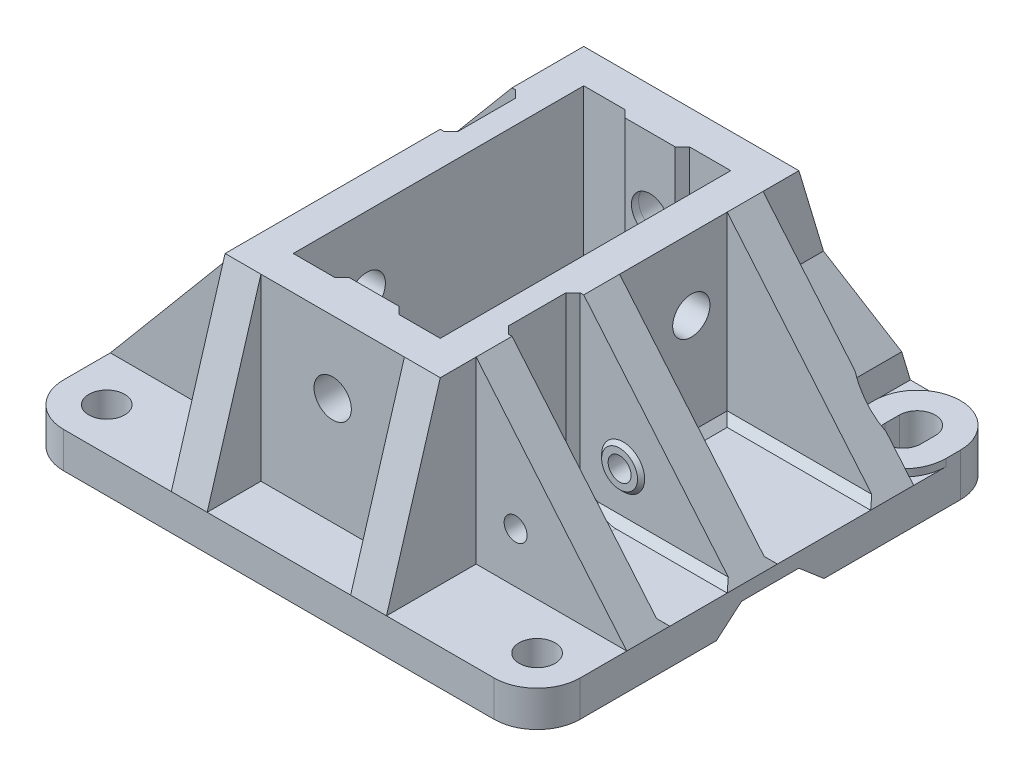
from build123d import *

# Parameters (mm, degrees)
SKETCH1_W               = 72
SKETCH1_H               = 65
BOSS_EXTRUDE1_DEPTH     = 5
SKETCH2_W               = 30
SKETCH2_H               = 50
BOSS_EXTRUDE2_DEPTH     = 25
SKETCH4_W               = 20.5
SKETCH4_H               = 40.5
CUT_EXTRUDE1_DEPTH      = 25
BOSS_EXTRUDE3_DEPTH     = 5
MIRROR2_COPY_1_DEPTH    = 5
BOSS_EXTRUDE4_START     = -5
BOSS_EXTRUDE4_DEPTH     = 5
BOSS_EXTRUDE5_DEPTH     = 5
MIRROR4_START           = -5
MIRROR4_COPY_1_DEPTH    = 5
BOSS_EXTRUDE6_DEPTH     = 5
FILLET1_R               = 6
CUT_EXTRUDE3_DEPTH      = 75
SKETCH11_R              = 2.5
CUT_EXTRUDE4_DEPTH      = 5
SKETCH12_R              = 1.6
CUT_EXTRUDE5_DEPTH      = 5
SKETCH13_R              = 2.602149029
CUT_EXTRUDE6_DEPTH      = 7
SKETCH14_W              = 7
SKETCH14_H              = 25
BOSS_EXTRUDE7_DEPTH     = 1
BOSS_EXTRUDE8_DEPTH     = 25
MIRROR8_COPY_1_DEPTH    = 25
MIRROR8_COPY_2_DEPTH    = 25
SKETCH16_R              = 2.6
CUT_EXTRUDE7_DEPTH      = 65
CUT_EXTRUDE8_DEPTH      = 102.533245787
CUT_EXTRUDE8_DEPTH_BACK = 25
FILLET5_R               = 7
CUT_EXTRUDE9_DEPTH      = 25
FILLET6_R               = 7
BOSS_EXTRUDE10_DEPTH    = 25
BOSS_EXTRUDE11_DEPTH    = 25
BOSS_EXTRUDE12_DEPTH    = 15
BOSS_EXTRUDE13_DEPTH    = 25
BOSS_EXTRUDE14_DEPTH    = 25
SKETCH28_W              = 39.163365543
SKETCH28_H              = 8.307401159
CUT_EXTRUDE10_DEPTH     = 5
BOSS_EXTRUDE15_DEPTH    = 25
BOSS_EXTRUDE16_DEPTH    = 15
BOSS_EXTRUDE17_DEPTH    = 25
SKETCH32_R              = 3
BOSS_EXTRUDE18_DEPTH    = 0.5
BOSS_EXTRUDE18_TAPER    = 45
SKETCH33_R              = 1.6
CUT_EXTRUDE11_DEPTH     = 20.5
SKETCH34_R              = 3
BOSS_EXTRUDE19_DEPTH    = 0.5
BOSS_EXTRUDE19_TAPER    = 45
CUT_EXTRUDE12_START     = -10.5
SKETCH35_R              = 1.6
CUT_EXTRUDE12_DEPTH     = 10.5
SKETCH37_R              = 3
BOSS_EXTRUDE20_DEPTH    = 0.5
BOSS_EXTRUDE20_TAPER    = 45
SKETCH38_R              = 3
BOSS_EXTRUDE21_DEPTH    = 0.5
BOSS_EXTRUDE21_TAPER    = 45
SKETCH36_R              = 1.6
CUT_EXTRUDE13_DEPTH     = 20.5
SKETCH40_R              = 2.6
CUT_EXTRUDE14_DEPTH     = 10
SKETCH41_R              = 2.6
CUT_EXTRUDE15_DEPTH     = 10
BOSS_EXTRUDE22_START    = 1
BOSS_EXTRUDE22_DEPTH    = 1
CUT_EXTRUDE17_DEPTH     = 11
CUT_EXTRUDE18_DEPTH     = 10
BOSS_EXTRUDE23_DEPTH    = 12.5
SKETCH50_R              = 2
CUT_EXTRUDE20_DEPTH     = 12.5
SKETCH49_W              = 13.457304279
SKETCH49_H              = 22.246433757
CUT_EXTRUDE21_DEPTH     = 12.5


with BuildPart() as part:
    # Sketch1 → Boss-Extrude1 (new body)
    with BuildSketch(Plane(origin=(0, 0, 0), x_dir=(1, 0, 0), z_dir=(0, 1, 0))):
        with Locations((36, 32.5)):
            Rectangle(SKETCH1_W, SKETCH1_H)
    extrude(amount=BOSS_EXTRUDE1_DEPTH)

    # Sketch2 → Boss-Extrude2 (add)
    with BuildSketch(Plane(origin=(0, 5, 0), x_dir=(1, 0, 0), z_dir=(0, 1, 0))):
        with Locations((36, 32.5)):
            Rectangle(SKETCH2_W, SKETCH2_H)
    extrude(amount=BOSS_EXTRUDE2_DEPTH)

    # Sketch4 → Cut-Extrude1 (cut)
    with BuildSketch(Plane(origin=(0, 30, 0), x_dir=(1, 0, 0), z_dir=(0, 1, 0))):
        with Locations((36, 32.5)):
            Rectangle(SKETCH4_W, SKETCH4_H)
    extrude(amount=-CUT_EXTRUDE1_DEPTH, mode=Mode.SUBTRACT)

    # Sketch5 → Boss-Extrude3 (add)
    with BuildSketch(Plane(origin=(51, 0, 0), x_dir=(0, 0, -1), z_dir=(1, 0, 0))):
        Polygon((57.5, 30), (65, 5), (57.5, 5), align=None)
    boss_extrude3 = extrude(amount=-BOSS_EXTRUDE3_DEPTH)

    # Mirror1: Boss-Extrude3 across plane
    add(boss_extrude3.mirror(Plane(origin=(36, 0, 0), x_dir=(0, 0, 1), z_dir=(1, 0, 0))))

    # Mirror2: Boss-Extrude3 across plane
    add(boss_extrude3.mirror(Plane.XY.offset(-32.5)))

    # Mirror2 copy 1 sketch → Mirror2 copy 1 (add)
    with BuildSketch(Plane(origin=(21, 0, -65), x_dir=(0, 0, 1), z_dir=(-1, 0, 0))):
        Polygon((57.5, 30), (65, 5), (57.5, 5), align=None)
    extrude(amount=-MIRROR2_COPY_1_DEPTH)

    # Sketch6 → Boss-Extrude4 (add)
    with BuildSketch(Plane.XY.offset(-7.5).offset(BOSS_EXTRUDE4_START)):
        Polygon((51, 30), (72, 5), (51, 5), align=None)
    boss_extrude4 = extrude(amount=-BOSS_EXTRUDE4_DEPTH)

    # Mirror3: Boss-Extrude4 across plane
    add(boss_extrude4.mirror(Plane.XY.offset(-32.5)))

    # Sketch7 → Boss-Extrude5 (add)
    with BuildSketch(Plane.XY.offset(-32.5)):
        Polygon((51, 30), (72, 5), (51, 5), align=None)
    extrude(amount=BOSS_EXTRUDE5_DEPTH)

    # Mirror4: Boss-Extrude4 across plane
    add(boss_extrude4.mirror(Plane(origin=(36, 0, 0), x_dir=(0, 0, 1), z_dir=(1, 0, 0))))

    # Mirror4 copy 1 sketch → Mirror4 copy 1 (add)
    with BuildSketch(Plane(origin=(72, 0, -57.5), x_dir=(-1, 0, 0), z_dir=(0, 0, -1)).offset(MIRROR4_START)):
        Polygon((51, 30), (72, 5), (51, 5), align=None)
    extrude(amount=-MIRROR4_COPY_1_DEPTH)

    # Sketch8 → Boss-Extrude6 (add)
    with BuildSketch(Plane.XY.offset(-32.5)):
        Polygon((21, 30), (0, 5), (21, 5), align=None)
    extrude(amount=-BOSS_EXTRUDE6_DEPTH)

    # Fillet1
    fillet1_edges = [part.edges().sort_by_distance(p)[0] for p in [
        (0, 2.5, -65),
        (0, 2.5, 0),
        (72, 2.5, 0),
        (72, 2.5, -65),
    ]]
    fillet(fillet1_edges, radius=FILLET1_R)

    # Sketch10 → Cut-Extrude3 (cut)
    with BuildSketch(Plane(origin=(72, 0, 0), x_dir=(0, 0, -1), z_dir=(1, 0, 0))):
        Polygon((40, 0), (36.5, 3), (32.5, 3), (28.5, 3), (25, 0), align=None)
    extrude(amount=-CUT_EXTRUDE3_DEPTH, mode=Mode.SUBTRACT)

    # Sketch11 → Cut-Extrude4 (cut)
    with BuildSketch(Plane(origin=(0, 5, 0), x_dir=(1, 0, 0), z_dir=(0, 1, 0))):
        with Locations((66, 6)):
            Circle(SKETCH11_R)
    cut_extrude4 = extrude(amount=-CUT_EXTRUDE4_DEPTH, mode=Mode.SUBTRACT)

    # Mirror6: Cut-Extrude4 across plane
    add(cut_extrude4.mirror(Plane(origin=(36, 0, 0), x_dir=(0, 0, 1), z_dir=(1, 0, 0))), mode=Mode.SUBTRACT)

    # Sketch12 → Cut-Extrude5 (cut)
    with BuildSketch(Plane.XY.offset(-12.5)):
        with Locations((56.5, 12)):
            Circle(SKETCH12_R)
    extrude(amount=-CUT_EXTRUDE5_DEPTH, mode=Mode.SUBTRACT)

    # Sketch13 → Cut-Extrude6 (cut)
    with BuildSketch(Plane.XY.offset(-7.5)):
        with Locations((36, 20)):
            Circle(SKETCH13_R)
    cut_extrude6 = extrude(amount=-CUT_EXTRUDE6_DEPTH, mode=Mode.SUBTRACT)

    # Sketch14 → Boss-Extrude7 (add)
    with BuildSketch(Plane(origin=(0, 0, -12.25), x_dir=(-1, 0, 0), z_dir=(0, 0, -1))):
        with Locations((-36, 17.5)):
            Rectangle(SKETCH14_W, SKETCH14_H)
    boss_extrude7 = extrude(amount=BOSS_EXTRUDE7_DEPTH)

    # Sketch15 → Boss-Extrude8 (add)
    with BuildSketch(Plane(origin=(0, 30, 0), x_dir=(1, 0, 0), z_dir=(0, 1, 0))):
        Polygon((39.5, 13.25), (40.5, 12.25), (39.5, 12.25), align=None)
    boss_extrude8 = extrude(amount=-BOSS_EXTRUDE8_DEPTH)

    # Mirror7: Boss-Extrude8 across plane
    add(boss_extrude8.mirror(Plane(origin=(36, 0, 0), x_dir=(0, 0, 1), z_dir=(1, 0, 0))))

    # Mirror8: Cut-Extrude6, Boss-Extrude7 across plane
    add(cut_extrude6.mirror(Plane.XY.offset(-32.5)), mode=Mode.SUBTRACT)
    add(boss_extrude7.mirror(Plane.XY.offset(-32.5)))

    # Mirror8 copy 1 sketch → Mirror8 copy 1 (add)
    with BuildSketch(Plane(origin=(72, 30, -65), x_dir=(-1, 0, 0), z_dir=(0, 1, 0))):
        Polygon((39.5, 13.25), (40.5, 12.25), (39.5, 12.25), align=None)
    extrude(amount=-MIRROR8_COPY_1_DEPTH)

    # Mirror8 copy 2 sketch → Mirror8 copy 2 (add)
    with BuildSketch(Plane(origin=(0, 30, -65), x_dir=(1, 0, 0), z_dir=(0, 1, 0))):
        Polygon((39.5, -13.25), (40.5, -12.25), (39.5, -12.25), align=None)
    extrude(amount=-MIRROR8_COPY_2_DEPTH)

    # Sketch16 → Cut-Extrude7 (cut)
    with BuildSketch(Plane.XY.offset(-12.25)):
        with Locations((36, 20)):
            Circle(SKETCH16_R)
    extrude(amount=-CUT_EXTRUDE7_DEPTH, mode=Mode.SUBTRACT)

    # Sketch21 → Cut-Extrude8 (cut, two sides: drawn at the far end of the back side and taken through both)
    with BuildSketch(Plane(origin=(0, 30, 0), x_dir=(1, 0, 0), z_dir=(0, 1, 0)).offset(-CUT_EXTRUDE8_DEPTH_BACK)):
        Polygon((21.5, 47.5), (22.5, 46.5), (22.5, 38.5), (21.5, 37.5), (21, 37.5), (21, 47.5), align=None)
    extrude(amount=CUT_EXTRUDE8_DEPTH + CUT_EXTRUDE8_DEPTH_BACK, mode=Mode.SUBTRACT)

    # Fillet5
    fillet5_edges = [part.edges().sort_by_distance(p)[0] for p in [
        (22.5, 5, -42.5),
    ]]
    fillet(fillet5_edges, radius=FILLET5_R)

    # Sketch22 → Cut-Extrude9 (cut)
    with BuildSketch(Plane(origin=(0, 30, 0), x_dir=(1, 0, 0), z_dir=(0, 1, 0))):
        Polygon((51, 17.5), (50.49936831, 17.5), (49.49936831, 18.5), (49.49936831, 26.5), (50.49936831, 27.5), (51, 27.5), align=None)
    extrude(amount=-CUT_EXTRUDE9_DEPTH, mode=Mode.SUBTRACT)

    # Fillet6
    fillet6_edges = [part.edges().sort_by_distance(p)[0] for p in [
        (49.49936831, 5, -22.5),
    ]]
    fillet(fillet6_edges, radius=FILLET6_R)

    # Sketch23 → Boss-Extrude10 (add)
    with BuildSketch(Plane(origin=(72, 0, 0), x_dir=(0, 0, -1), z_dir=(1, 0, 0))):
        Polygon((17.5, 5), (17.5, 5.998380503), (18.502323497, 5), align=None)
    extrude(amount=-BOSS_EXTRUDE10_DEPTH)

    # Sketch24 → Boss-Extrude11 (add)
    with BuildSketch(Plane(origin=(72, 0, 0), x_dir=(0, 0, -1), z_dir=(1, 0, 0))):
        Polygon((27.5, 5), (27.5, 6), (26.5, 5), align=None)
    extrude(amount=-BOSS_EXTRUDE11_DEPTH)

    # Sketch25 → Boss-Extrude12 (add)
    with BuildSketch(Plane(origin=(0, 0, -32.5), x_dir=(-1, 0, 0), z_dir=(0, 0, -1))):
        Polygon((-51, 5), (-51, 5.997769202), (-52, 5), align=None)
    extrude(amount=BOSS_EXTRUDE12_DEPTH)

    # Sketch26 → Boss-Extrude13 (add)
    with BuildSketch(Plane(origin=(72, 0, 0), x_dir=(0, 0, -1), z_dir=(1, 0, 0))):
        Polygon((32.5, 5), (32.5, 5.997218908), (33.5, 5), align=None)
    extrude(amount=-BOSS_EXTRUDE13_DEPTH)

    # Sketch27 → Boss-Extrude14 (add)
    with BuildSketch(Plane(origin=(72, 0, 0), x_dir=(0, 0, -1), z_dir=(1, 0, 0))):
        Polygon((47.5, 5), (47.5, 6), (46.5, 5), align=None)
    extrude(amount=-BOSS_EXTRUDE14_DEPTH)

    # Sketch28 → Cut-Extrude10 (cut)
    with BuildSketch(Plane(origin=(44.676360225, 37.528142589, 0), x_dir=(0, 0, -1), z_dir=(0.7657048647896111, 0.6431920864232733, 0))):
        with Locations((30.993839272, -39.424779611)):
            Rectangle(SKETCH28_W, SKETCH28_H)
    cut_extrude10 = extrude(amount=CUT_EXTRUDE10_DEPTH, mode=Mode.SUBTRACT)

    # Sketch29 → Boss-Extrude15 (add)
    with BuildSketch(Plane.ZY):
        Polygon((-47.5, 5), (-47.5, 6), (-46.5, 5), align=None)
        Polygon((-37.5, 5), (-37.5, 6), (-38.5, 5), align=None)
    extrude(amount=-BOSS_EXTRUDE15_DEPTH)

    # Sketch30 → Boss-Extrude16 (add)
    with BuildSketch(Plane.XY.offset(-32.5)):
        Polygon((21, 5), (20, 5), (21, 6), align=None)
    extrude(amount=BOSS_EXTRUDE16_DEPTH)

    # Sketch31 → Boss-Extrude17 (add)
    with BuildSketch(Plane.ZY):
        Polygon((-32.5, 5), (-32.5, 6), (-31.5, 5), align=None)
        Polygon((-17.5, 5), (-17.5, 6.000584877), (-18.500584877, 5), align=None)
    extrude(amount=-BOSS_EXTRUDE17_DEPTH)

    # Mirror10: Cut-Extrude10 across plane
    add(cut_extrude10.mirror(Plane(origin=(36, 0, 0), x_dir=(0, 0, 1), z_dir=(1, 0, 0))), mode=Mode.SUBTRACT)

    # Sketch32 → Boss-Extrude18 (add)
    with BuildSketch(Plane(origin=(0, 0, -17.5), x_dir=(-1, 0, 0), z_dir=(0, 0, -1))):
        with Locations((-56.5, 12)):
            Circle(SKETCH32_R)
    extrude(amount=BOSS_EXTRUDE18_DEPTH, taper=BOSS_EXTRUDE18_TAPER)

    # Sketch33 → Cut-Extrude11 (cut)
    with BuildSketch(Plane.XY.offset(-12.5)):
        with Locations((56.5, 12)):
            Circle(SKETCH33_R)
    extrude(amount=-CUT_EXTRUDE11_DEPTH, mode=Mode.SUBTRACT)

    # Sketch34 → Boss-Extrude19 (add)
    with BuildSketch(Plane.XY.offset(-27.5)):
        with Locations((56.5, 12)):
            Circle(SKETCH34_R)
    extrude(amount=BOSS_EXTRUDE19_DEPTH, taper=BOSS_EXTRUDE19_TAPER)

    # Sketch35 → Cut-Extrude12 (cut)
    with BuildSketch(Plane(origin=(0, 0, -32.5), x_dir=(-1, 0, 0), z_dir=(0, 0, -1)).offset(CUT_EXTRUDE12_START)):
        with Locations((-56.5, 12)):
            Circle(SKETCH35_R)
    extrude(amount=CUT_EXTRUDE12_DEPTH, mode=Mode.SUBTRACT)

    # Sketch37 → Boss-Extrude20 (add)
    with BuildSketch(Plane.XY.offset(-47.5)):
        with Locations((15.5, 12)):
            Circle(SKETCH37_R)
    extrude(amount=BOSS_EXTRUDE20_DEPTH, taper=BOSS_EXTRUDE20_TAPER)

    # Sketch38 → Boss-Extrude21 (add)
    with BuildSketch(Plane(origin=(0, 0, -37.5), x_dir=(-1, 0, 0), z_dir=(0, 0, -1))):
        with Locations((-15.5, 12)):
            Circle(SKETCH38_R)
    extrude(amount=BOSS_EXTRUDE21_DEPTH, taper=BOSS_EXTRUDE21_TAPER)

    # Sketch36 → Cut-Extrude13 (cut)
    with BuildSketch(Plane(origin=(0, 0, -52.5), x_dir=(-1, 0, 0), z_dir=(0, 0, -1))):
        with Locations((-15.5, 12)):
            Circle(SKETCH36_R)
    extrude(amount=-CUT_EXTRUDE13_DEPTH, mode=Mode.SUBTRACT)

    # Sketch40 → Cut-Extrude14 (cut)
    with BuildSketch(Plane.ZY.offset(-21)):
        with Locations((-22.5, 20)):
            Circle(SKETCH40_R)
    extrude(amount=-CUT_EXTRUDE14_DEPTH, mode=Mode.SUBTRACT)

    # Sketch41 → Cut-Extrude15 (cut)
    with BuildSketch(Plane(origin=(51, 0, 0), x_dir=(0, 0, -1), z_dir=(1, 0, 0))):
        with Locations((42.5, 20)):
            Circle(SKETCH41_R)
    extrude(amount=-CUT_EXTRUDE15_DEPTH, mode=Mode.SUBTRACT)

    # Sketch9 → Boss-Extrude22 (add)
    with BuildSketch(Plane(origin=(0, 5, 0), x_dir=(1, 0, 0), z_dir=(0, 1, 0)).offset(BOSS_EXTRUDE22_START)):
        with BuildLine():
            Line((60, 59), (60, 57))
            ThreePointArc((60, 57), (66, 51), (72, 57))
            Line((72, 57), (72, 59))
            ThreePointArc((72, 59), (66, 65), (60, 59))
        make_face()
        with BuildLine():
            Line((63.5, 59), (63.5, 57))
            ThreePointArc((63.5, 57), (66, 54.5), (68.5, 57))
            Line((68.5, 57), (68.5, 59))
            ThreePointArc((68.5, 59), (66, 61.5), (63.5, 59))
        make_face(mode=Mode.SUBTRACT)
    boss_extrude22 = extrude(amount=-BOSS_EXTRUDE22_DEPTH)

    # Sketch45 → Cut-Extrude17 (cut)
    with BuildSketch(Plane(origin=(0, 6, 0), x_dir=(1, 0, 0), z_dir=(0, 1, 0))):
        with BuildLine():
            Line((68.179449472, 52.5), (63.80757516, 52.506307385))
            ThreePointArc((63.80757516, 52.506307385), (65.992786414, 52.000005204), (68.179449472, 52.5))
        make_face()
    cut_extrude17 = extrude(amount=CUT_EXTRUDE17_DEPTH, mode=Mode.SUBTRACT)

    # Sketch47 → Cut-Extrude18 (cut)
    with BuildSketch(Plane(origin=(0, 5, 0), x_dir=(1, 0, 0), z_dir=(0, 1, 0))):
        with BuildLine():
            Line((68.5, 59), (68.5, 57))
            ThreePointArc((68.5, 57), (66, 54.5), (63.5, 57))
            Line((63.5, 57), (63.5, 59))
            ThreePointArc((63.5, 59), (66, 61.5), (68.5, 59))
        make_face()
    extrude(amount=-CUT_EXTRUDE18_DEPTH, mode=Mode.SUBTRACT)

    # Mirror12: Boss-Extrude22, Cut-Extrude17 across plane
    add(boss_extrude22.mirror(Plane(origin=(36, 0, 0), x_dir=(0, 0, 1), z_dir=(1, 0, 0))))
    add(cut_extrude17.mirror(Plane(origin=(36, 0, 0), x_dir=(0, 0, 1), z_dir=(1, 0, 0))), mode=Mode.SUBTRACT)

    # Sketch48 → Boss-Extrude23 (add)
    with BuildSketch(Plane(origin=(0, 0, -52.5), x_dir=(-1, 0, 0), z_dir=(0, 0, -1))):
        Polygon((-59.034845121, 5), (-59.034845121, 9), (-51, 18.575555539), (-51, 5), align=None)
    extrude(amount=BOSS_EXTRUDE23_DEPTH)

    # Sketch50 → Cut-Extrude20 (cut)
    with BuildSketch(Plane(origin=(0, 0, -65), x_dir=(-1, 0, 0), z_dir=(0, 0, -1))):
        with Locations((-52.534845121, 7)):
            Circle(SKETCH50_R)
    extrude(amount=-CUT_EXTRUDE20_DEPTH, mode=Mode.SUBTRACT)

    # Sketch49 → Cut-Extrude21 (cut)
    with BuildSketch(Plane(origin=(0, 18.302752294, -61.009174312), x_dir=(-1, 0, 0), z_dir=(0, 0.28734788556634494, -0.9578262852211515))):
        with Locations((-55.129520737, -3.512971616)):
            Rectangle(SKETCH49_W, SKETCH49_H)
    extrude(amount=CUT_EXTRUDE21_DEPTH, mode=Mode.SUBTRACT)


solid = part.part
